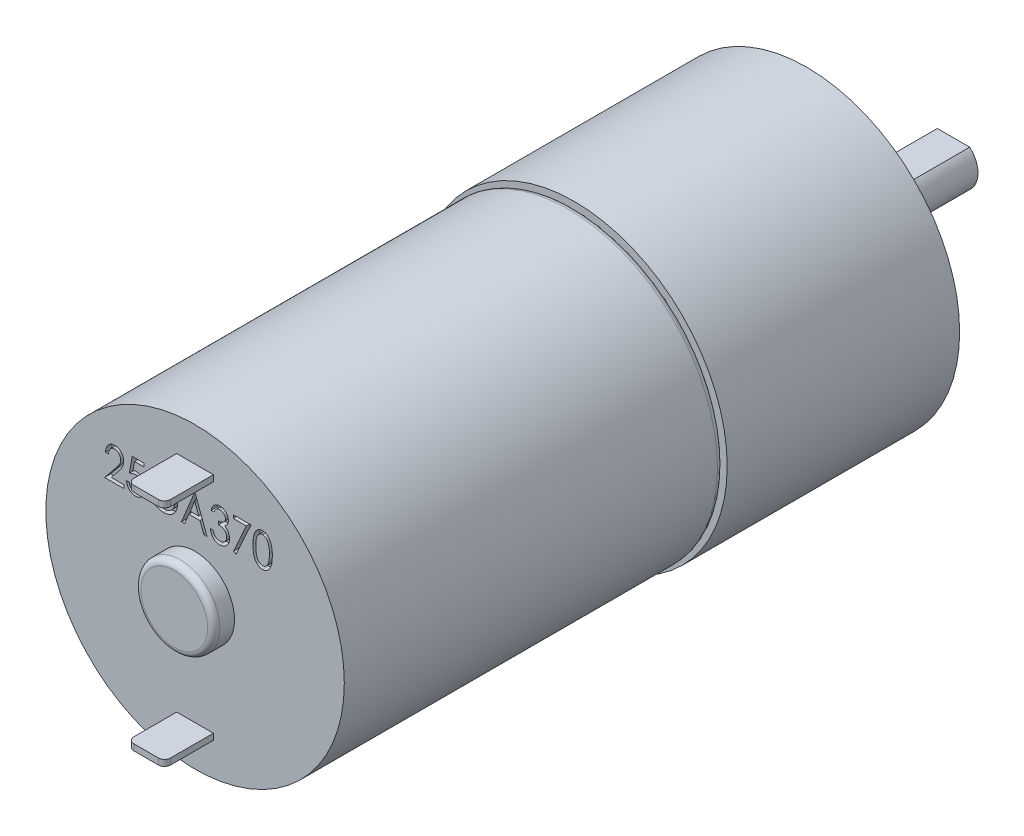
from build123d import *

# Parameters (mm, degrees)
SKETCH1_R              = 12.2
BOSS_EXTRUDE1_DEPTH    = 31
FILLET1_R              = 0.5
SKETCH2_R              = 12.5
BOSS_EXTRUDE2_DEPTH    = 19
SKETCH4_R              = 3.5
BOSS_EXTRUDE3_DEPTH    = 2.5
SKETCH6_R              = 2
BOSS_EXTRUDE4_DEPTH    = 9.5
CUT_EXTRUDE1_START     = -8
CUT_EXTRUDE1_DEPTH     = 8
FILLET2_R              = 1
SKETCH9_R              = 3.225
BOSS_EXTRUDE5_DEPTH    = 1.7
FILLET3_R              = 0.5
SKETCH10_W             = 3
SKETCH10_H             = 0.5
BOSS_EXTRUDE6_DEPTH    = 4
FILLET4_R              = 0.5
HOLE_WIZARD_M3_1_D     = 2.5
HOLE_WIZARD_M3_1_DEPTH = 3.5
HOLE_WIZARD_M3_1_TIP   = 0.751075774
FILLET5_R              = 0.25
CUT_EXTRUDE2_DEPTH     = 0.5


with BuildPart() as part:
    # Sketch1 → Boss-Extrude1 (new body)
    with BuildSketch(Plane.XY):
        Circle(SKETCH1_R)
    extrude(amount=BOSS_EXTRUDE1_DEPTH)

    # Fillet1
    fillet1_edges = [part.edges().sort_by_distance(p)[0] for p in [
        (-12.2, 0, 0),
    ]]
    fillet(fillet1_edges, radius=FILLET1_R)

    # Sketch2 → Boss-Extrude2 (add)
    with BuildSketch(Plane(origin=(0, 0, 0), x_dir=(-1, 0, 0), z_dir=(0, 0, -1))):
        Circle(SKETCH2_R)
    extrude(amount=BOSS_EXTRUDE2_DEPTH)

    # Sketch4 → Boss-Extrude3 (add)
    with BuildSketch(Plane(origin=(0, 0, -19), x_dir=(-1, 0, 0), z_dir=(0, 0, -1))):
        Circle(SKETCH4_R)
    extrude(amount=BOSS_EXTRUDE3_DEPTH)

    # Sketch6 → Boss-Extrude4 (add)
    with BuildSketch(Plane(origin=(0, 0, -21.5), x_dir=(-1, 0, 0), z_dir=(0, 0, -1))):
        Circle(SKETCH6_R)
    extrude(amount=BOSS_EXTRUDE4_DEPTH)

    # Sketch7 → Cut-Extrude1 (cut)
    with BuildSketch(Plane(origin=(0, 0, -31), x_dir=(-1, 0, 0), z_dir=(0, 0, -1)).offset(CUT_EXTRUDE1_START)):
        with BuildLine():
            Line((-1.322875656, 1.5), (1.322875656, 1.5))
            ThreePointArc((1.322875656, 1.5), (0, 2), (-1.322875656, 1.5))
        make_face()
    extrude(amount=CUT_EXTRUDE1_DEPTH, mode=Mode.SUBTRACT)

    # Fillet2
    # the kernel refuses this fillet: 1 mm, written as the material it adds along each edge
    with BuildSketch(Plane(origin=(3.822875656, 1.5, -23), x_dir=(0, 0, -1), z_dir=(-1, 0, 0))) as fillet2_piece_1_section:
        with BuildLine():
            CenterArc((FILLET2_R, -FILLET2_R), FILLET2_R, 90, 90)
            Line((0, -FILLET2_R), (0, 0))
            Line((0, 0), (FILLET2_R, 0))
        make_face()
    fillet2_piece_1 = extrude(amount=7.645751311, mode=Mode.PRIVATE)
    fillet2_piece_1 = fillet2_piece_1 & Plane(origin=(0, 0, -23.282143702), x_dir=(-1, 0, 0), z_dir=(0, 0, 1)) * Cylinder(2, 20, mode=Mode.PRIVATE)
    add(fillet2_piece_1)

    # Sketch9 → Boss-Extrude5 (add)
    with BuildSketch(Plane.XY.offset(31)):
        Circle(SKETCH9_R)
    extrude(amount=BOSS_EXTRUDE5_DEPTH)

    # Fillet3
    fillet3_edges = [part.edges().sort_by_distance(p)[0] for p in [
        (-3.225, 0, 32.7),
    ]]
    fillet(fillet3_edges, radius=FILLET3_R)

    # Sketch10 → Boss-Extrude6 (add)
    with BuildSketch(Plane.XY.offset(31)):
        with Locations((0, 9.15)):
            Rectangle(SKETCH10_W, SKETCH10_H)
        with Locations((0, -9.15)):
            Rectangle(SKETCH10_W, SKETCH10_H)
    extrude(amount=BOSS_EXTRUDE6_DEPTH)

    # Fillet4
    fillet4_edges = [part.edges().sort_by_distance(p)[0] for p in [
        (-1.5, 9.15, 35),
        (1.5, 9.15, 35),
        (1.5, -9.15, 35),
        (-1.5, -9.15, 35),
    ]]
    fillet(fillet4_edges, radius=FILLET4_R)

    # M3 螺纹孔的螺纹孔钻头1
    with Locations(Plane(origin=(0, 0, -19), x_dir=(-1, 0, 0), z_dir=(0, 0, -1))):
        with Locations((0, 8.5), (0, -8.5)):
            Hole(HOLE_WIZARD_M3_1_D / 2, depth=HOLE_WIZARD_M3_1_DEPTH)
            with Locations((0, 0, -(HOLE_WIZARD_M3_1_DEPTH + HOLE_WIZARD_M3_1_TIP / 2))):  # 118° drill point
                Cone(0, HOLE_WIZARD_M3_1_D / 2, HOLE_WIZARD_M3_1_TIP, mode=Mode.SUBTRACT)

    # Fillet5
    fillet5_edges = [part.edges().sort_by_distance(p)[0] for p in [
        (3.5, 0, -21.5),
    ]]
    fillet(fillet5_edges, radius=FILLET5_R)

    # Sketch14 → Cut-Extrude2 (cut)
    # profile 1 of 7: a face of its own
    with BuildSketch(Plane.XY.offset(31)):
        with BuildLine():
            Line((-7.086733536, 6.578565467), (-7.321861303, 6.578565467))
            add(Edge.make_bspline(
                [(-7.321861303, 6.578565467), (-7.320418172, 6.60974622), (-7.31758686, 6.670920438), (-7.305247783, 6.760216418), (-7.287231462, 6.845557121), (-7.261203229, 6.926130194), (-7.229731965, 7.003077005), (-7.191371463, 7.075467858), (-7.146509884, 7.143762298), (-7.095203506, 7.20674821), (-7.039570271, 7.264250848), (-6.980002129, 7.314729609), (-6.91665913, 7.356578544), (-6.850670855, 7.39194977), (-6.781049377, 7.418434978), (-6.708520801, 7.43819141), (-6.632609554, 7.449961427), (-6.580829969, 7.451245425), (-6.554547028, 7.451897173)],
                knots=[0, 0, 0, 0, 1.157388701, 2.270706855, 3.339969662, 4.388770879, 5.407173851, 6.420352507, 7.422937862, 8.433452555, 9.429357235, 10.387433346, 11.323406098, 12.240766834, 13.159137072, 14.080094821, 15.025470071, 16, 16, 16, 16], degree=3))
            add(Edge.make_bspline(
                [(-6.554547028, 7.451897173), (-6.528614908, 7.451225759), (-6.477905671, 7.449912837), (-6.403803984, 7.438618213), (-6.333685206, 7.420125895), (-6.266855514, 7.395066817), (-6.204107496, 7.361602123), (-6.145208622, 7.32102297), (-6.089919873, 7.273322691), (-6.039854928, 7.218302667), (-5.993862657, 7.15906915), (-5.953939602, 7.096195377), (-5.919392895, 7.031163004), (-5.892241835, 6.962896649), (-5.870669892, 6.89232914), (-5.854669023, 6.819195656), (-5.845847357, 6.74323306), (-5.844565332, 6.691777128), (-5.843915339, 6.665688702)],
                knots=[0, 0, 0, 0, 1.051800275, 2.056753934, 3.03304212, 3.990199343, 4.946039437, 5.910878896, 6.887218698, 7.901977988, 8.924307075, 9.926649808, 10.920510366, 11.907859407, 12.902632229, 13.912088839, 14.94141816, 16, 16, 16, 16], degree=3))
            add(Edge.make_bspline(
                [(-5.843915339, 6.665688702), (-5.844996443, 6.628880674), (-5.847134883, 6.556073832), (-5.865062658, 6.448846496), (-5.894039894, 6.345184715), (-5.928143236, 6.261126232), (-5.962680485, 6.193189137), (-5.994088188, 6.137886271), (-6.031239625, 6.078443191), (-6.073241974, 6.014280691), (-6.120827901, 5.945837923), (-6.174259365, 5.873351105), (-6.232273836, 5.796038096), (-6.273802057, 5.743795391), (-6.295276677, 5.716780214)],
                knots=[0, 0, 0, 0, 1.233482511, 2.439847245, 3.633928361, 4.836450955, 5.473897344, 6.188356043, 6.968050959, 7.823797873, 8.759406765, 9.762507455, 10.842972314, 12, 12, 12, 12], degree=3))
            Line((-6.295276677, 5.716780214), (-6.850556091, 5.033440141))
            Line((-6.850556091, 5.033440141), (-5.810325658, 5.033440141))
            Line((-5.810325658, 5.033440141), (-5.810325658, 4.764722693))
            Line((-5.810325658, 4.764722693), (-7.389040665, 4.764722693))
            Line((-7.389040665, 4.764722693), (-6.508361216, 5.849039583))
            add(Edge.make_bspline(
                [(-6.508361216, 5.849039583), (-6.486954391, 5.874879483), (-6.445781429, 5.92457883), (-6.387492768, 5.99699476), (-6.335035424, 6.064201391), (-6.287951369, 6.125929882), (-6.247882002, 6.183184453), (-6.212747013, 6.234668808), (-6.183928533, 6.28129054), (-6.153035375, 6.336074676), (-6.123509144, 6.402838948), (-6.097201158, 6.483760146), (-6.082299339, 6.567347403), (-6.080134865, 6.623645958), (-6.079043106, 6.652042894)],
                knots=[0, 0, 0, 0, 1.297809128, 2.496150027, 3.595226863, 4.595304601, 5.498308645, 6.297775467, 7.005697546, 7.617561311, 8.729167951, 9.822669443, 10.901756619, 12, 12, 12, 12], degree=3))
            add(Edge.make_bspline(
                [(-6.079043106, 6.652042894), (-6.079384934, 6.669911366), (-6.080057807, 6.705084674), (-6.087208839, 6.756706053), (-6.098238741, 6.806392861), (-6.113423189, 6.854462751), (-6.133350621, 6.900497582), (-6.157772259, 6.944632814), (-6.186896183, 6.986565841), (-6.219459785, 7.026654776), (-6.255510515, 7.06317299), (-6.293769283, 7.095511299), (-6.33448414, 7.122241234), (-6.376889089, 7.144716935), (-6.421442258, 7.16203446), (-6.467980526, 7.173980889), (-6.516330029, 7.181668244), (-6.549268833, 7.182668705), (-6.56609348, 7.183179725)],
                knots=[0, 0, 0, 0, 1.06989504, 2.106041779, 3.115552866, 4.11659498, 5.121251965, 6.115853611, 7.133385419, 8.176137438, 9.206329872, 10.203413544, 11.171427972, 12.118447235, 13.074126855, 14.027447124, 14.992449553, 16, 16, 16, 16], degree=3))
            add(Edge.make_bspline(
                [(-6.56609348, 7.183179725), (-6.583612628, 7.182644575), (-6.618106851, 7.181590894), (-6.668814568, 7.174174869), (-6.717195972, 7.161596399), (-6.763328847, 7.143900561), (-6.807551604, 7.122269887), (-6.84890471, 7.094199295), (-6.888218349, 7.061808221), (-6.924877515, 7.024445065), (-6.95863105, 6.982918736), (-6.988562561, 6.936954944), (-7.014897172, 6.887109941), (-7.03668648, 6.832947056), (-7.056099814, 6.775318274), (-7.069463511, 6.713065071), (-7.081131231, 6.647311576), (-7.084833483, 6.601881086), (-7.086733536, 6.578565467)],
                knots=[0, 0, 0, 0, 0.947670143, 1.865909634, 2.765819934, 3.646511421, 4.53540404, 5.422682691, 6.343698459, 7.287389961, 8.249693905, 9.234132192, 10.250229907, 11.294287865, 12.389763132, 13.535482573, 14.735172158, 16, 16, 16, 16], degree=3))
        make_face()
    # profile 2 of 7: a face of its own
    with BuildSketch(Plane.XY.offset(31)):
        with BuildLine():
            Line((-4.16443129, 7.384717811), (-4.16443129, 7.116000363))
            Line((-4.16443129, 7.116000363), (-4.946965889, 7.116000363))
            Line((-4.946965889, 7.116000363), (-5.071352676, 6.422688354))
            add(Edge.make_bspline(
                [(-5.071352676, 6.422688354), (-5.047502468, 6.431108461), (-5.001517314, 6.447343118), (-4.933097568, 6.464818063), (-4.868208185, 6.475212968), (-4.826111346, 6.476955174), (-4.805784261, 6.477796424)],
                knots=[0, 0, 0, 0, 1.113143318, 2.146231409, 3.104880253, 4, 4, 4, 4], degree=3))
            add(Edge.make_bspline(
                [(-4.805784261, 6.477796424), (-4.78054475, 6.47716718), (-4.731013694, 6.475932326), (-4.658673504, 6.46395035), (-4.589725122, 6.444910084), (-4.524044334, 6.4188655), (-4.461802515, 6.384634726), (-4.40302705, 6.343077915), (-4.347443692, 6.293922529), (-4.296589197, 6.237078897), (-4.249524796, 6.17544292), (-4.208806649, 6.108482218), (-4.174285145, 6.037657729), (-4.145478094, 5.962617817), (-4.124415332, 5.882976392), (-4.108567901, 5.799342481), (-4.098976954, 5.711404682), (-4.097834855, 5.651374235), (-4.097251928, 5.62073472)],
                knots=[0, 0, 0, 0, 0.973560614, 1.910555428, 2.821466426, 3.73059852, 4.631163213, 5.556699778, 6.503883695, 7.488691105, 8.49622651, 9.493389215, 10.5081404, 11.534042417, 12.590644417, 13.683294485, 14.817554483, 16, 16, 16, 16], degree=3))
            add(Edge.make_bspline(
                [(-4.097251928, 5.62073472), (-4.098619231, 5.578327367), (-4.101311992, 5.494810526), (-4.120936034, 5.372294297), (-4.15432553, 5.255244007), (-4.192885332, 5.162643216), (-4.229193785, 5.092307375), (-4.259246382, 5.043026575), (-4.291195939, 4.996524161), (-4.32594798, 4.953541016), (-4.362728433, 4.913531525), (-4.401699283, 4.876543206), (-4.44326727, 4.842810921), (-4.487374222, 4.812698525), (-4.53290144, 4.78490757), (-4.581020813, 4.762172127), (-4.630311733, 4.741981511), (-4.681551363, 4.725667596), (-4.734544857, 4.713068836), (-4.789304746, 4.704425021), (-4.845700529, 4.698109149), (-4.883966833, 4.697733926), (-4.903404271, 4.697543331)],
                knots=[0, 0, 0, 0, 1.854240742, 3.651732996, 5.409993055, 7.166221002, 8.028594238, 8.869695635, 9.688937347, 10.494306344, 11.284856283, 12.064219686, 12.842117024, 13.623131146, 14.398616627, 15.171985563, 15.947735206, 16.72687324, 17.521153864, 18.327430933, 19.15041553, 20, 20, 20, 20], degree=3))
            add(Edge.make_bspline(
                [(-4.903404271, 4.697543331), (-4.926365782, 4.698064225), (-4.971638702, 4.699091265), (-5.037986792, 4.709753886), (-5.102017084, 4.725073577), (-5.163001861, 4.747910972), (-5.221378491, 4.776897763), (-5.276398618, 4.813015461), (-5.329421528, 4.854635788), (-5.378892411, 4.902760145), (-5.424280947, 4.95621435), (-5.465379811, 5.013611795), (-5.501815612, 5.074840195), (-5.533197989, 5.139826595), (-5.55960878, 5.208672662), (-5.580942625, 5.281189127), (-5.597969377, 5.357457376), (-5.605140055, 5.409860402), (-5.608787572, 5.436516313)],
                knots=[0, 0, 0, 0, 0.980012484, 1.932278219, 2.86391096, 3.788442921, 4.707522156, 5.642386417, 6.594769441, 7.583067065, 8.584946701, 9.586603339, 10.595260768, 11.624716315, 12.665609409, 13.74146141, 14.851146399, 16, 16, 16, 16], degree=3))
            Line((-5.608787572, 5.436516313), (-5.373659805, 5.436516313))
            add(Edge.make_bspline(
                [(-5.373659805, 5.436516313), (-5.368904939, 5.411553801), (-5.359797559, 5.363741077), (-5.338809261, 5.296628656), (-5.314735358, 5.236167254), (-5.284359184, 5.183098146), (-5.249196448, 5.136086232), (-5.208799909, 5.094387255), (-5.163657736, 5.056806602), (-5.1131974, 5.025152151), (-5.059906037, 4.998778197), (-5.004002097, 4.98056602), (-4.947158344, 4.968199416), (-4.908542129, 4.966907), (-4.889233625, 4.966260779)],
                knots=[0, 0, 0, 0, 1.237908536, 2.371066588, 3.422813746, 4.404583581, 5.342816831, 6.277826636, 7.229035638, 8.199176782, 9.175745742, 10.119776575, 11.059868941, 12, 12, 12, 12], degree=3))
            add(Edge.make_bspline(
                [(-4.889233625, 4.966260779), (-4.870474357, 4.966875705), (-4.833441504, 4.968089636), (-4.778928412, 4.977477188), (-4.726214995, 4.991731482), (-4.676131315, 5.013539878), (-4.62720254, 5.039268222), (-4.581793346, 5.073273545), (-4.537180774, 5.111476993), (-4.495829646, 5.155906531), (-4.457616009, 5.204460218), (-4.423816406, 5.256519542), (-4.395512531, 5.311800286), (-4.372218009, 5.369924711), (-4.354407223, 5.430939971), (-4.3420044, 5.494905263), (-4.333771093, 5.561739322), (-4.332849627, 5.607413537), (-4.332379695, 5.630706656)],
                knots=[0, 0, 0, 0, 0.933673813, 1.843174603, 2.747905908, 3.645942738, 4.55819341, 5.494019063, 6.463585747, 7.480531844, 8.510567353, 9.537614091, 10.566285436, 11.598455736, 12.651591861, 13.726309059, 14.840453956, 16, 16, 16, 16], degree=3))
            add(Edge.make_bspline(
                [(-4.332379695, 5.630706656), (-4.332661602, 5.651726999), (-4.333213185, 5.692855521), (-4.341074498, 5.752828081), (-4.352288559, 5.809810217), (-4.368694733, 5.863770268), (-4.389775437, 5.914642535), (-4.414857347, 5.962990408), (-4.445620962, 6.007532893), (-4.480261893, 6.048960113), (-4.518288366, 6.086968602), (-4.560434778, 6.119479343), (-4.605675313, 6.146857299), (-4.653460237, 6.170567739), (-4.705226905, 6.187334534), (-4.75959299, 6.20023079), (-4.817135396, 6.207499669), (-4.856499446, 6.208544471), (-4.876637494, 6.209078976)],
                knots=[0, 0, 0, 0, 1.127360635, 2.20580017, 3.240687026, 4.241666562, 5.226843905, 6.192863443, 7.15906549, 8.125632452, 9.088360914, 10.038692719, 10.974299228, 11.923377817, 12.894313054, 13.887334147, 14.919192329, 16, 16, 16, 16], degree=3))
            add(Edge.make_bspline(
                [(-4.876637494, 6.209078976), (-4.894148493, 6.20864374), (-4.930324788, 6.207744578), (-4.985740322, 6.201140222), (-5.043893263, 6.190472784), (-5.104682063, 6.175713445), (-5.168247664, 6.156728984), (-5.234523344, 6.133372991), (-5.303631071, 6.106354363), (-5.349956835, 6.085427605), (-5.373659805, 6.074720252)],
                knots=[0, 0, 0, 0, 0.810269167, 1.673950008, 2.579134618, 3.545268136, 4.567349434, 5.647883586, 6.7965197, 8, 8, 8, 8], degree=3))
            Line((-5.373659805, 6.074720252), (-5.138532038, 7.384717811))
            Line((-5.138532038, 7.384717811), (-4.16443129, 7.384717811))
        make_face()
    # profile 3 of 7: a face of its own
    with BuildSketch(Plane.XY.offset(31)):
        with BuildLine():
            Line((-1.544436172, 6.937555182), (-1.721831675, 6.746513872))
            add(Edge.make_bspline(
                [(-1.721831675, 6.746513872), (-1.753585318, 6.780717433), (-1.815902469, 6.847842597), (-1.918132901, 6.936296878), (-2.025253906, 7.0112601), (-2.135804699, 7.073055047), (-2.247578127, 7.122040219), (-2.358986384, 7.156804943), (-2.468999161, 7.179262742), (-2.542227335, 7.181885354), (-2.57836854, 7.183179725)],
                knots=[0, 0, 0, 0, 1.131335406, 2.220268106, 3.271452375, 4.297255123, 5.287332592, 6.225418144, 7.124168701, 8, 8, 8, 8], degree=3))
            add(Edge.make_bspline(
                [(-2.57836854, 7.183179725), (-2.600435255, 7.182871195), (-2.644519337, 7.182254827), (-2.71005484, 7.17432384), (-2.774984592, 7.162972298), (-2.839025026, 7.146665056), (-2.902291091, 7.125489827), (-2.964762686, 7.099810045), (-3.026405981, 7.069135526), (-3.086776444, 7.034108316), (-3.145526726, 6.995715175), (-3.200590732, 6.952825598), (-3.25289284, 6.907328169), (-3.301107142, 6.8576718), (-3.346330936, 6.805097328), (-3.388588692, 6.749411618), (-3.426789627, 6.689995604), (-3.461317322, 6.627658777), (-3.491851624, 6.563322519), (-3.519816926, 6.49816464), (-3.541797546, 6.431396051), (-3.561197449, 6.364332059), (-3.575126902, 6.296000415), (-3.585698359, 6.227011002), (-3.592210412, 6.156894697), (-3.593006445, 6.109897961), (-3.593406713, 6.086266705)],
                knots=[0, 0, 0, 0, 0.957531822, 1.912922289, 2.862011677, 3.818126519, 4.778906464, 5.756414481, 6.748306359, 7.765809291, 8.7854363, 9.792709949, 10.793778567, 11.792828027, 12.794645581, 13.803350139, 14.825181505, 15.858773772, 16.894958351, 17.916281442, 18.934719513, 19.944681594, 20.945750212, 21.959816919, 22.974139614, 24, 24, 24, 24], degree=3))
            add(Edge.make_bspline(
                [(-3.593406713, 6.086266705), (-3.5930665, 6.062104405), (-3.592387166, 6.013857259), (-3.584941217, 5.942077727), (-3.574940869, 5.87097446), (-3.559288784, 5.800974589), (-3.540198653, 5.731581), (-3.515623344, 5.663490255), (-3.488088226, 5.595914922), (-3.455385606, 5.530232896), (-3.419668217, 5.466275842), (-3.379397403, 5.405927375), (-3.336727898, 5.34859461), (-3.289861226, 5.295284995), (-3.240477575, 5.244893148), (-3.186955918, 5.198679962), (-3.130865936, 5.155503994), (-3.071632127, 5.116138514), (-3.009730249, 5.081247474), (-2.946371331, 5.049933411), (-2.881114685, 5.0243711), (-2.81446212, 5.003294664), (-2.746527593, 4.986245255), (-2.676957778, 4.975168179), (-2.606198602, 4.967114452), (-2.558448475, 4.966547643), (-2.534282084, 4.966260779)],
                knots=[0, 0, 0, 0, 1.014396523, 2.02554134, 3.028295436, 4.028488902, 5.035755334, 6.048980313, 7.066909895, 8.098719958, 9.128566039, 10.141391319, 11.143606878, 12.127885461, 13.120248603, 14.104527185, 15.095038902, 16.091555175, 17.088585988, 18.077706861, 19.057367231, 20.028698393, 21.012400885, 21.995664224, 22.985603477, 24, 24, 24, 24], degree=3))
            add(Edge.make_bspline(
                [(-2.534282084, 4.966260779), (-2.505382036, 4.966977293), (-2.448438625, 4.968389081), (-2.36469039, 4.979244383), (-2.284106344, 4.996230663), (-2.207174827, 5.021107291), (-2.133783549, 5.052847621), (-2.063571245, 5.09110681), (-1.99728722, 5.137295931), (-1.934495562, 5.189527109), (-1.876532058, 5.247510805), (-1.824281828, 5.310181221), (-1.778603835, 5.377059131), (-1.738784914, 5.44788132), (-1.705865672, 5.523043859), (-1.67911207, 5.602460775), (-1.65766994, 5.685719223), (-1.649395229, 5.743270997), (-1.645205215, 5.772413123)],
                knots=[0, 0, 0, 0, 1.051129639, 2.071100652, 3.067302124, 4.04351983, 5.007123942, 5.972764852, 6.947321263, 7.941528173, 8.940653207, 9.925896293, 10.905696917, 11.883075849, 12.877649407, 13.886036726, 14.929565851, 16, 16, 16, 16], degree=3))
            Line((-1.645205215, 5.772413123), (-2.384178197, 5.772413123))
            Line((-2.384178197, 5.772413123), (-2.384178197, 6.041130571))
            Line((-2.384178197, 6.041130571), (-1.410077448, 6.041130571))
            add(Edge.make_bspline(
                [(-1.410077448, 6.041130571), (-1.411349629, 5.991061506), (-1.413837211, 5.893158039), (-1.428442394, 5.750300817), (-1.452856641, 5.615242354), (-1.487747459, 5.488433298), (-1.531016258, 5.369029713), (-1.584674335, 5.257895505), (-1.648185963, 5.154824848), (-1.720211098, 5.060014376), (-1.800575186, 4.974803822), (-1.888008478, 4.900198091), (-1.982503052, 4.837386379), (-2.083547553, 4.78627955), (-2.190832422, 4.745980327), (-2.304795513, 4.717903776), (-2.425295347, 4.700782769), (-2.507807317, 4.698639834), (-2.550027247, 4.697543331)],
                knots=[0, 0, 0, 0, 1.210777789, 2.367516602, 3.468589441, 4.525646522, 5.54414491, 6.535575829, 7.504180693, 8.467040959, 9.40969031, 10.331064482, 11.240365786, 12.146591654, 13.063565696, 14.005445851, 14.979421581, 16, 16, 16, 16], degree=3))
            add(Edge.make_bspline(
                [(-2.550027247, 4.697543331), (-2.575930993, 4.697969947), (-2.627102585, 4.698812706), (-2.702767316, 4.704803678), (-2.776426146, 4.713954612), (-2.848008201, 4.727918429), (-2.917734751, 4.744851319), (-2.985109531, 4.766635153), (-3.050430391, 4.791954208), (-3.114061185, 4.820664732), (-3.175383426, 4.853731289), (-3.234411503, 4.890858392), (-3.291845172, 4.93111174), (-3.346810303, 4.975941199), (-3.400150727, 5.024237373), (-3.450827975, 5.077089546), (-3.500459863, 5.132841016), (-3.53085639, 5.172838829), (-3.546171224, 5.192991126)],
                knots=[0, 0, 0, 0, 1.073875762, 2.121389401, 3.145205683, 4.149514963, 5.14345099, 6.118334554, 7.082773847, 8.046831216, 9.010670274, 9.968651073, 10.936629604, 11.916492246, 12.907433166, 13.917930903, 14.950980736, 16, 16, 16, 16], degree=3))
            add(Edge.make_bspline(
                [(-3.546171224, 5.192991126), (-3.568821895, 5.224967851), (-3.613902669, 5.288609918), (-3.670433968, 5.390522581), (-3.720146935, 5.495154063), (-3.759084167, 5.604360076), (-3.790446464, 5.716900392), (-3.812061951, 5.83334917), (-3.826496739, 5.953293876), (-3.82784974, 6.034614448), (-3.82853448, 6.07576993)],
                knots=[0, 0, 0, 0, 0.996546363, 1.983388519, 2.961352749, 3.941584443, 4.929901843, 5.931448132, 6.953127772, 8, 8, 8, 8], degree=3))
            add(Edge.make_bspline(
                [(-3.82853448, 6.07576993), (-3.827992038, 6.106574463), (-3.826914874, 6.167745186), (-3.819447592, 6.258706415), (-3.807013346, 6.347946949), (-3.788808502, 6.435461682), (-3.766580311, 6.52147713), (-3.738448239, 6.605884342), (-3.705461366, 6.68857813), (-3.667718399, 6.769421777), (-3.625554642, 6.847115214), (-3.579202608, 6.920872214), (-3.529226314, 6.990264463), (-3.475832343, 7.055711628), (-3.417750959, 7.11585248), (-3.356751039, 7.172518108), (-3.291658568, 7.2244326), (-3.222802774, 7.27161335), (-3.151203533, 7.314094995), (-3.077010406, 7.350980883), (-3.000444338, 7.381959226), (-2.921846083, 7.407951022), (-2.840461901, 7.427182619), (-2.757010387, 7.441199972), (-2.671308487, 7.450708566), (-2.613383489, 7.451498432), (-2.584141767, 7.451897173)],
                knots=[0, 0, 0, 0, 1.07164269, 2.128036097, 3.172988306, 4.204309344, 5.236222884, 6.262087682, 7.297370218, 8.332062181, 9.364280816, 10.37073307, 11.360577134, 12.33782248, 13.306405567, 14.266923389, 15.232672116, 16.200030553, 17.16870925, 18.126832918, 19.079625504, 20.040066188, 21.004048815, 21.985643799, 22.983111838, 24, 24, 24, 24], degree=3))
            add(Edge.make_bspline(
                [(-2.584141767, 7.451897173), (-2.560338222, 7.45145357), (-2.512838098, 7.450568358), (-2.442224085, 7.444686746), (-2.372520111, 7.43513623), (-2.303902316, 7.422296207), (-2.236520108, 7.404728138), (-2.170169979, 7.38358894), (-2.104605041, 7.359220187), (-2.040241565, 7.329984614), (-1.976662003, 7.296844341), (-1.913453472, 7.259554992), (-1.850899797, 7.217254017), (-1.788451409, 7.170608501), (-1.726479284, 7.119060067), (-1.665239729, 7.062783985), (-1.60403505, 7.002298591), (-1.564557505, 6.959413373), (-1.544436172, 6.937555182)],
                knots=[0, 0, 0, 0, 0.953642326, 1.902999293, 2.83675562, 3.771511039, 4.698004985, 5.624578465, 6.56059437, 7.498576395, 8.454739615, 9.432017672, 10.437052158, 11.478597186, 12.553703354, 13.664985171, 14.809864987, 16, 16, 16, 16], degree=3))
        make_face()
    # profile 4 of 7: a face of its own
    with BuildSketch(Plane.XY.offset(31)):
        Polygon((0.000689153, 7.384717811), (0.974789902, 4.764722693), (0.719718262, 4.764722693), (0.407964035, 5.604464718), (-0.504205739, 5.604464718), (-0.848499969, 4.764722693), (-1.10777032, 4.764722693), (-0.032900528, 7.384717811), align=None)
        Polygon((-0.025552785, 6.770131616), (-0.39346476, 5.873182166), (0.307719831, 5.873182166), align=None, mode=Mode.SUBTRACT)
    # profile 5 of 7: a face of its own
    with BuildSketch(Plane.XY.offset(31)):
        with BuildLine():
            Line((1.545814479, 6.780103553), (1.310686712, 6.780103553))
            add(Edge.make_bspline(
                [(1.310686712, 6.780103553), (1.316644501, 6.806432606), (1.328258647, 6.857758595), (1.351043013, 6.931776986), (1.377730796, 7.001041808), (1.408203273, 7.06578982), (1.442216979, 7.126077154), (1.480940763, 7.181236111), (1.522581787, 7.232608678), (1.569182553, 7.277889536), (1.617680477, 7.319239659), (1.669385781, 7.354168094), (1.722741638, 7.384567084), (1.7784332, 7.409307878), (1.836535216, 7.428184683), (1.8967795, 7.441827553), (1.959132037, 7.450547253), (2.001520756, 7.45144469), (2.022892916, 7.451897173)],
                knots=[0, 0, 0, 0, 1.213646873, 2.365889363, 3.479226314, 4.54912843, 5.581579656, 6.587705624, 7.576924878, 8.55050232, 9.505464024, 10.439453725, 11.351887816, 12.264152294, 13.174752891, 14.094686289, 15.039351257, 16, 16, 16, 16], degree=3))
            add(Edge.make_bspline(
                [(2.022892916, 7.451897173), (2.054121634, 7.450854915), (2.116051767, 7.448787998), (2.206938691, 7.430167237), (2.294534245, 7.400461972), (2.377943978, 7.359705813), (2.455430172, 7.309214775), (2.524400151, 7.249421905), (2.583637663, 7.181121196), (2.632731777, 7.105458151), (2.671819547, 7.025151807), (2.700567482, 6.942245966), (2.71803414, 6.857283985), (2.720310809, 6.799952199), (2.721453313, 6.771181294)],
                knots=[0, 0, 0, 0, 1.037475548, 2.057433109, 3.071083532, 4.106583696, 5.136003477, 6.138035553, 7.131860785, 8.132253496, 9.128731291, 10.094580144, 11.043800018, 12, 12, 12, 12], degree=3))
            add(Edge.make_bspline(
                [(2.721453313, 6.771181294), (2.720547141, 6.743482224), (2.718774905, 6.689310092), (2.704827935, 6.610261187), (2.681704541, 6.535577284), (2.648889081, 6.465401758), (2.606954063, 6.39954228), (2.555586377, 6.338584877), (2.495275448, 6.281668791), (2.449482142, 6.24896433), (2.425969088, 6.232171882)],
                knots=[0, 0, 0, 0, 1.034740432, 2.023681557, 2.989439786, 3.948891607, 4.910213012, 5.898894732, 6.921165452, 8, 8, 8, 8], degree=3))
            add(Edge.make_bspline(
                [(2.425969088, 6.232171882), (2.451043951, 6.218651102), (2.501100096, 6.191660002), (2.568923378, 6.139484244), (2.630281063, 6.078796393), (2.664326652, 6.032189748), (2.681565567, 6.008590568)],
                knots=[0, 0, 0, 0, 0.994457701, 1.985203988, 2.979812114, 4, 4, 4, 4], degree=3))
            add(Edge.make_bspline(
                [(2.681565567, 6.008590568), (2.692917138, 5.991290643), (2.715523572, 5.956838179), (2.743374946, 5.902018365), (2.767929838, 5.846062462), (2.787806925, 5.788506116), (2.803049706, 5.729324553), (2.814039472, 5.668641167), (2.821160207, 5.60638424), (2.821866978, 5.564246363), (2.822222356, 5.543058583)],
                knots=[0, 0, 0, 0, 1.00515716, 2.001751025, 2.984458985, 3.97420733, 4.958128942, 5.952324961, 6.970387383, 8, 8, 8, 8], degree=3))
            add(Edge.make_bspline(
                [(2.822222356, 5.543058583), (2.820823822, 5.506416822), (2.818040617, 5.433496503), (2.798206458, 5.325225406), (2.764119415, 5.220091256), (2.71826328, 5.11868605), (2.661231226, 5.024240783), (2.593428038, 4.939700454), (2.51572673, 4.866656477), (2.428832861, 4.805808457), (2.334721268, 4.756973246), (2.23391587, 4.72321827), (2.127949334, 4.701058506), (2.055197033, 4.698728964), (2.018169368, 4.697543331)],
                knots=[0, 0, 0, 0, 1.014707837, 2.019357588, 3.036907717, 4.069166202, 5.095504868, 6.084608755, 7.061626644, 8.038980938, 9.014218756, 9.987287233, 10.975619287, 12, 12, 12, 12], degree=3))
            add(Edge.make_bspline(
                [(2.018169368, 4.697543331), (1.993304607, 4.698188915), (1.944461779, 4.69945706), (1.872661075, 4.70824437), (1.804233596, 4.724251418), (1.738831394, 4.745740561), (1.67638361, 4.773241035), (1.616954692, 4.806748088), (1.560984279, 4.847059315), (1.508531421, 4.893381948), (1.459507806, 4.945295923), (1.415352166, 5.003553284), (1.375394404, 5.067346678), (1.339735568, 5.136686003), (1.308694921, 5.211874546), (1.282112709, 5.292570812), (1.259894833, 5.379211338), (1.24907294, 5.439235947), (1.24350735, 5.470105994)],
                knots=[0, 0, 0, 0, 0.990513423, 1.945704551, 2.875515556, 3.785713825, 4.684393021, 5.589454026, 6.498450854, 7.426798081, 8.373433753, 9.338011181, 10.333830724, 11.368661367, 12.440314751, 13.570898844, 14.750737914, 16, 16, 16, 16], degree=3))
            Line((1.24350735, 5.470105994), (1.478635117, 5.470105994))
            add(Edge.make_bspline(
                [(1.478635117, 5.470105994), (1.483633454, 5.449915786), (1.493353538, 5.410652623), (1.511633803, 5.354672798), (1.529978467, 5.30247299), (1.551225144, 5.255110714), (1.573713004, 5.211912788), (1.597829881, 5.172775445), (1.623821945, 5.138110786), (1.643071604, 5.117775869), (1.652356748, 5.107967246)],
                knots=[0, 0, 0, 0, 1.227409514, 2.386898646, 3.474821375, 4.49196229, 5.448190758, 6.348047463, 7.203174547, 8, 8, 8, 8], degree=3))
            add(Edge.make_bspline(
                [(1.652356748, 5.107967246), (1.664743605, 5.096691375), (1.689276802, 5.074358577), (1.729614834, 5.045459266), (1.772022699, 5.020324816), (1.817711034, 5.001400355), (1.865045594, 4.985094287), (1.915280849, 4.974457092), (1.967923735, 4.96723908), (2.003972846, 4.96659132), (2.022368078, 4.966260779)],
                knots=[0, 0, 0, 0, 0.987786239, 1.956392453, 2.923291289, 3.889914458, 4.869410071, 5.873943724, 6.915110651, 8, 8, 8, 8], degree=3))
            add(Edge.make_bspline(
                [(2.022368078, 4.966260779), (2.043219027, 4.96671033), (2.083852164, 4.967586389), (2.143139919, 4.976008893), (2.199493497, 4.987925175), (2.252319532, 5.006971435), (2.302665808, 5.029723967), (2.349292685, 5.058840406), (2.392836314, 5.092875133), (2.432925696, 5.131404031), (2.468728691, 5.173732002), (2.500368502, 5.217936263), (2.527612565, 5.263720917), (2.548802291, 5.311878144), (2.566621536, 5.361337422), (2.578563674, 5.412947669), (2.585353212, 5.466250142), (2.586509849, 5.502277042), (2.587094589, 5.520490516)],
                knots=[0, 0, 0, 0, 1.131388683, 2.204785482, 3.246441662, 4.252851856, 5.247356788, 6.241181003, 7.22926868, 8.243715995, 9.254465245, 10.235036049, 11.192984918, 12.141087045, 13.087426855, 14.043631555, 15.010953923, 16, 16, 16, 16], degree=3))
            add(Edge.make_bspline(
                [(2.587094589, 5.520490516), (2.586199783, 5.54487764), (2.58442056, 5.593368691), (2.569691101, 5.664709736), (2.545971346, 5.733567118), (2.512788752, 5.798845331), (2.47234728, 5.859349144), (2.424894065, 5.913195939), (2.370054328, 5.95803884), (2.319195532, 5.989228686), (2.273996668, 6.009986528), (2.23563182, 6.024233747), (2.192817195, 6.035899847), (2.145978045, 6.047142805), (2.094447776, 6.056426198), (2.038582757, 6.064141841), (1.978373606, 6.070539609), (1.936831397, 6.073293151), (1.915300969, 6.074720252)],
                knots=[0, 0, 0, 0, 1.19277501, 2.371698767, 3.54972029, 4.748382554, 5.945391955, 7.103829679, 8.24739154, 9.400245482, 10.013276171, 10.679775806, 11.400814213, 12.18386578, 13.037095876, 13.962316118, 14.943912534, 16, 16, 16, 16], degree=3))
            Line((1.915300969, 6.074720252), (1.915300969, 6.3434377))
            add(Edge.make_bspline(
                [(1.915300969, 6.3434377), (1.942822196, 6.344002881), (1.996918493, 6.345113813), (2.075734505, 6.358019958), (2.15129486, 6.376426284), (2.221660876, 6.403722323), (2.285828393, 6.436232), (2.341623789, 6.473318837), (2.387608979, 6.515341184), (2.424296933, 6.561514583), (2.452152309, 6.610923291), (2.471717428, 6.66281951), (2.484542306, 6.716672466), (2.485728002, 6.753613919), (2.486325546, 6.772230971)],
                knots=[0, 0, 0, 0, 1.243740816, 2.444722913, 3.604071008, 4.756374622, 5.850061341, 6.853181308, 7.777365241, 8.656145985, 9.510167359, 10.331781837, 11.159283104, 12, 12, 12, 12], degree=3))
            add(Edge.make_bspline(
                [(2.486325546, 6.772230971), (2.485933173, 6.785902032), (2.485154258, 6.81304094), (2.478621447, 6.852772221), (2.468527904, 6.891290417), (2.454581779, 6.9283996), (2.435759525, 6.963955874), (2.413217866, 6.998169471), (2.386247924, 7.030669714), (2.355794947, 7.061462232), (2.322759742, 7.090424223), (2.286291798, 7.114802621), (2.248183302, 7.1362344), (2.207884759, 7.153445738), (2.165305897, 7.166691552), (2.120660715, 7.175994739), (2.073784474, 7.181921861), (2.041805051, 7.182755255), (2.02551711, 7.183179725)],
                knots=[0, 0, 0, 0, 0.954298075, 1.894410913, 2.804261135, 3.732387345, 4.655998667, 5.60826082, 6.589174048, 7.600068601, 8.631142096, 9.651225118, 10.65760524, 11.681194716, 12.705294547, 13.766901717, 14.862625692, 16, 16, 16, 16], degree=3))
            add(Edge.make_bspline(
                [(2.02551711, 7.183179725), (1.999345138, 7.182140298), (1.948147168, 7.180106958), (1.874391313, 7.162117929), (1.80586027, 7.133589606), (1.75378973, 7.099660829), (1.71559199, 7.066122039), (1.687702788, 7.037272208), (1.661242538, 7.004098251), (1.635672302, 6.967174223), (1.611774525, 6.925792428), (1.587825595, 6.881287713), (1.56592216, 6.83222359), (1.552655333, 6.797835363), (1.545814479, 6.780103553)],
                knots=[0, 0, 0, 0, 1.395445339, 2.729789254, 4.027341734, 5.343352216, 6.025171276, 6.738565338, 7.482488129, 8.288221053, 9.133992859, 10.032284056, 10.985374711, 12, 12, 12, 12], degree=3))
        make_face()
    # profile 6 of 7: a face of its own
    with BuildSketch(Plane.XY.offset(31)):
        Polygon((3.124529485, 7.384717811), (4.568885768, 7.384717811), (3.359657252, 4.697543331), (3.147622391, 4.813532699), (4.183654114, 7.116000363), (3.124529485, 7.116000363), align=None)
    # profile 7 of 7: a face of its own
    with BuildSketch(Plane.XY.offset(31)):
        with BuildLine():
            add(Edge.make_bspline(
                [(4.736834173, 6.073670575), (4.737096047, 6.115663946), (4.737604696, 6.197229326), (4.742685227, 6.31603787), (4.749391836, 6.427608176), (4.760754274, 6.531705368), (4.774030309, 6.628426689), (4.790768501, 6.717771587), (4.810465552, 6.799853594), (4.833843182, 6.87491099), (4.859622635, 6.944369501), (4.888471557, 7.008754808), (4.919757274, 7.06886358), (4.952304474, 7.125379641), (4.988950054, 7.176657572), (5.026985819, 7.22431383), (5.068456529, 7.266936823), (5.111668286, 7.305913578), (5.157544828, 7.339750932), (5.204249153, 7.370088452), (5.252631334, 7.395257143), (5.302369892, 7.415836374), (5.353231381, 7.43221874), (5.405580311, 7.44378224), (5.459167854, 7.450813764), (5.495379951, 7.451534583), (5.513595545, 7.451897173)],
                knots=[0, 0, 0, 0, 1.712737898, 3.326718361, 4.849934128, 6.270757035, 7.596796976, 8.831195979, 9.976938934, 11.037759367, 12.035809522, 12.997271036, 13.913248545, 14.799301666, 15.654562441, 16.48149021, 17.283916513, 18.077408965, 18.852363637, 19.606538973, 20.347018853, 21.073229694, 21.799896157, 22.523578351, 23.257322845, 24, 24, 24, 24], degree=3))
            add(Edge.make_bspline(
                [(5.513595545, 7.451897173), (5.532162251, 7.451545433), (5.568900387, 7.450849442), (5.623338649, 7.443709272), (5.676431845, 7.432329301), (5.728080771, 7.415700237), (5.778655715, 7.395437703), (5.827694447, 7.369882655), (5.875558726, 7.340036414), (5.921604042, 7.305102656), (5.966625794, 7.266476407), (6.008392065, 7.222175282), (6.047684388, 7.173401686), (6.086063426, 7.121137501), (6.120098644, 7.062970296), (6.15302763, 7.001036746), (6.182642722, 6.934033225), (6.210780066, 6.862625315), (6.23543847, 6.78548524), (6.256858056, 6.702408574), (6.275090479, 6.613052297), (6.290315879, 6.517464561), (6.301836568, 6.415363139), (6.309157456, 6.306952184), (6.314909898, 6.192344687), (6.315332381, 6.113916249), (6.315549179, 6.073670575)],
                knots=[0, 0, 0, 0, 0.752180744, 1.488347903, 2.221332102, 2.950188717, 3.684954335, 4.427073921, 5.188489928, 5.968499684, 6.767646011, 7.590201753, 8.43188258, 9.305659254, 10.215299127, 11.160505459, 12.147606989, 13.182625504, 14.270232933, 15.427717507, 16.658470434, 17.96531266, 19.349783444, 20.821468742, 22.368931779, 24, 24, 24, 24], degree=3))
            add(Edge.make_bspline(
                [(6.315549179, 6.073670575), (6.31525068, 6.03360383), (6.314669105, 5.955540529), (6.310047108, 5.841396712), (6.301666508, 5.733572208), (6.290209885, 5.632023087), (6.275658267, 5.53691181), (6.257748913, 5.447961075), (6.237284244, 5.365051795), (6.212150127, 5.288527242), (6.18491303, 5.217363999), (6.154935751, 5.150942304), (6.122293846, 5.089033116), (6.087883743, 5.031073847), (6.050559131, 4.977873492), (6.010460114, 4.929343372), (5.96802774, 4.885275172), (5.923368699, 4.845628343), (5.876449041, 4.811299201), (5.828862796, 4.780278149), (5.779122823, 4.755382892), (5.728613715, 4.733989923), (5.676560316, 4.717733386), (5.623303305, 4.706405698), (5.568943769, 4.698420282), (5.532169177, 4.697837617), (5.513595545, 4.697543331)],
                knots=[0, 0, 0, 0, 1.625791635, 3.16758111, 4.634362493, 6.013326105, 7.313513755, 8.537269154, 9.694283847, 10.776350794, 11.803341178, 12.785072982, 13.731335007, 14.641990848, 15.518412538, 16.365536825, 17.193923029, 17.998641004, 18.785212613, 19.551271023, 20.300534794, 21.03882223, 21.775264372, 22.509067235, 23.246979152, 24, 24, 24, 24], degree=3))
            add(Edge.make_bspline(
                [(5.513595545, 4.697543331), (5.495380272, 4.69790736), (5.459168811, 4.698631039), (5.40557656, 4.705641407), (5.353459814, 4.717236411), (5.302797668, 4.733208688), (5.253119378, 4.752857), (5.205386758, 4.778581718), (5.158636786, 4.807888825), (5.113268557, 4.84146269), (5.070359488, 4.88003164), (5.029125027, 4.92253138), (4.990818575, 4.970176787), (4.954828695, 5.021988411), (4.920947169, 5.077968851), (4.889993458, 5.13851), (4.861931541, 5.203730427), (4.835374409, 5.273444918), (4.811367632, 5.348975395), (4.792015569, 5.431746186), (4.774408117, 5.52130024), (4.761328622, 5.618096936), (4.750067705, 5.721851183), (4.74248753, 5.832852749), (4.737665762, 5.950989969), (4.737116444, 6.032028297), (4.736834173, 6.073670575)],
                knots=[0, 0, 0, 0, 0.743613562, 1.478283201, 2.202877853, 2.921494687, 3.645913188, 4.380999621, 5.13229658, 5.898229586, 6.68263495, 7.486072995, 8.314043399, 9.176234408, 10.060926981, 10.984410639, 11.950736434, 12.959248835, 14.030356592, 15.184487265, 16.428798955, 17.756510839, 19.172020399, 20.690514867, 22.299391159, 24, 24, 24, 24], degree=3))
        make_face()
        with BuildLine():
            add(Edge.make_bspline(
                [(4.97196194, 6.074720252), (4.972149373, 6.03972835), (4.972513075, 5.971828958), (4.975710618, 5.873132119), (4.980775541, 5.781064961), (4.988166986, 5.695658839), (4.997247617, 5.616798), (5.009539081, 5.544575547), (5.022776272, 5.478767913), (5.038822139, 5.419265711), (5.056526204, 5.364626296), (5.077390562, 5.314270571), (5.099037634, 5.266836236), (5.123516411, 5.22326174), (5.149051215, 5.18236198), (5.177420947, 5.145361069), (5.207481328, 5.111374752), (5.249421985, 5.071665022), (5.304397141, 5.029911775), (5.374666687, 4.993560456), (5.447108211, 4.970673306), (5.496468392, 4.967723446), (5.520943288, 4.966260779)],
                knots=[0, 0, 0, 0, 1.533539051, 2.975727605, 4.327350958, 5.574085108, 6.732432991, 7.805117054, 8.784043935, 9.673055441, 10.504702577, 11.299185573, 12.060685142, 12.788272239, 13.488058854, 14.171998547, 14.82910999, 15.474486357, 16.70125626, 17.839742354, 18.928851556, 20, 20, 20, 20], degree=3))
            add(Edge.make_bspline(
                [(5.520943288, 4.966260779), (5.545614338, 4.967450837), (5.595041777, 4.96983507), (5.666937829, 4.993315541), (5.736834136, 5.027893526), (5.790606744, 5.069366264), (5.831771909, 5.108226574), (5.86147816, 5.1417448), (5.889138094, 5.178727948), (5.914210359, 5.219583555), (5.938095933, 5.263447616), (5.960019031, 5.310887839), (5.979405326, 5.362229376), (5.990667996, 5.397796861), (5.99644721, 5.416047601)],
                knots=[0, 0, 0, 0, 1.260031109, 2.524420714, 3.838978787, 5.240585022, 5.982240997, 6.737630522, 7.53163645, 8.34478141, 9.190888301, 10.089069349, 11.019444295, 12, 12, 12, 12], degree=3))
            add(Edge.make_bspline(
                [(5.99644721, 5.416047601), (6.003373695, 5.439417818), (6.017441828, 5.486884221), (6.033681296, 5.56083236), (6.048782603, 5.637727965), (6.059825709, 5.718390984), (6.069727483, 5.802329006), (6.07544072, 5.890096034), (6.080156264, 5.98124804), (6.080332065, 6.043222973), (6.080421412, 6.074720252)],
                knots=[0, 0, 0, 0, 0.877554436, 1.782369142, 2.725190345, 3.699077286, 4.713512245, 5.768404222, 6.865844737, 8, 8, 8, 8], degree=3))
            add(Edge.make_bspline(
                [(6.080421412, 6.074720252), (6.080281864, 6.106215231), (6.080008868, 6.167828465), (6.076073854, 6.257947056), (6.070604276, 6.343743283), (6.062069034, 6.425112086), (6.05170261, 6.502149075), (6.039218198, 6.574864933), (6.024144298, 6.643227124), (6.00603094, 6.707155483), (5.987032126, 6.767090676), (5.965172394, 6.822450043), (5.942262209, 6.873867196), (5.917717136, 6.92140592), (5.890844379, 6.964430583), (5.862568497, 7.003641935), (5.832059085, 7.038335905), (5.790047254, 7.078180757), (5.735076895, 7.119298655), (5.666064256, 7.156568235), (5.593993242, 7.178642591), (5.54522707, 7.181671459), (5.520943288, 7.183179725)],
                knots=[0, 0, 0, 0, 1.381209292, 2.702042534, 3.955571768, 5.151192574, 6.289502008, 7.36425752, 8.386253595, 9.358021076, 10.277650789, 11.142548216, 11.966806051, 12.745861644, 13.486804304, 14.189703291, 14.86387237, 15.509720055, 16.726644761, 17.862702138, 18.935703305, 20, 20, 20, 20], degree=3))
            add(Edge.make_bspline(
                [(5.520943288, 7.183179725), (5.496312177, 7.181669072), (5.446864018, 7.178636362), (5.373900931, 7.156671919), (5.30422455, 7.119501067), (5.249479874, 7.078070409), (5.207345237, 7.039090756), (5.177395119, 7.005273528), (5.149640624, 6.967950993), (5.123995344, 6.927257847), (5.099622687, 6.883627412), (5.077737493, 6.836358736), (5.057884077, 6.785623063), (5.039078595, 6.731370333), (5.023558808, 6.671621893), (5.009229904, 6.606220277), (4.997904016, 6.533808117), (4.988799099, 6.454811399), (4.980636956, 6.369277224), (4.975729606, 6.277005629), (4.97250516, 6.178137079), (4.972146663, 6.109887364), (4.97196194, 6.074720252)],
                knots=[0, 0, 0, 0, 1.078543429, 2.165228563, 3.306998572, 4.522771429, 5.16274981, 5.819718716, 6.498896924, 7.198531744, 7.925961016, 8.687295404, 9.478752755, 10.312654144, 11.20147281, 12.181777119, 13.24542559, 14.411133613, 15.665913912, 17.009590841, 18.45912833, 20, 20, 20, 20], degree=3))
        make_face(mode=Mode.SUBTRACT)
    extrude(amount=-CUT_EXTRUDE2_DEPTH, mode=Mode.SUBTRACT)


solid = part.part
